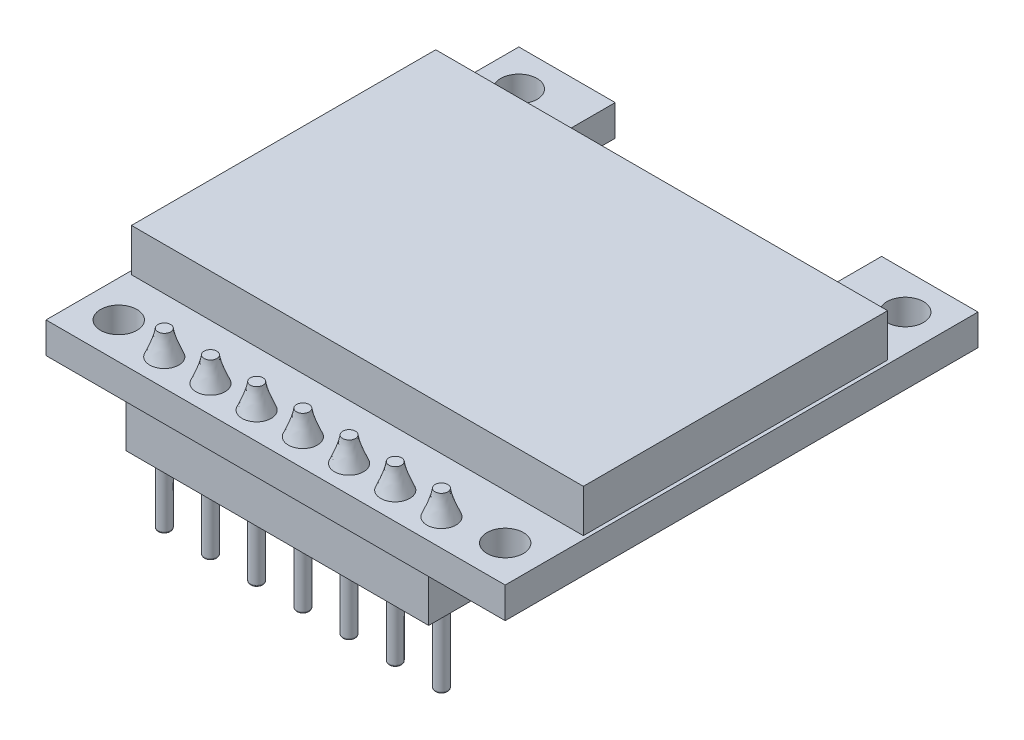
from build123d import *

# Parameters (mm, degrees)
SKETCH_1_W             = 25.25
SKETCH_1_H             = 26
EXTRUDE_1_DEPTH        = 1.7
SKETCH_3_R             = 1
CUT_EXTRUDE_3_DEPTH    = 2
SKETCH_7_W             = 24.85
SKETCH_7_H             = 16.73
EXTRUDE_4_DEPTH        = 2.35
SKETCH_9_W             = 14.65
SKETCH_9_H             = 4.77
CUT_EXTRUDE_5_DEPTH    = 1.7
EXTRUDE_5_DEPTH        = 1.36
EXTRUDE_5_DEPTH_BACK   = 8.2
SKETCH_10_R            = 0.35
PATTERN_LINEAR_1_COUNT = 7
PATTERN_LINEAR_1_PITCH = 2.54
SKETCH_13_W            = 18.36
SKETCH_13_H            = 2.8
EXTRUDE_6_DEPTH        = 2.43
FILLET_2_R             = 0.5
FILLET_3_R             = 0.1
SKETCH_14_W            = 0.86
SKETCH_14_H            = 2.8
CUT_EXTRUDE_6_DEPTH    = 2.5


with BuildPart() as part:
    # 草图1 → 凸台-拉伸1 (new body)
    with BuildSketch(Plane(origin=(0, 0, 0), x_dir=(1, 0, 0), z_dir=(0, 1, 0))):
        Rectangle(SKETCH_1_W, SKETCH_1_H)
    extrude(amount=EXTRUDE_1_DEPTH)

    # 草图3 → 切除-拉伸3 (cut)
    with BuildSketch(Plane(origin=(0, 0, 0), x_dir=(1, 0, 0), z_dir=(0, 1, 0))):
        with Locations(Location((-10.625, -11, 0), (0, 0, 270))):
            Circle(SKETCH_3_R)
        with Locations(Location((10.625, -11, 0), (0, 0, 90))):
            Circle(SKETCH_3_R)
        with Locations(Location((-10.625, 11, 0), (0, 0, 270))):
            Circle(SKETCH_3_R)
        with Locations(Location((10.625, 11, 0), (0, 0, 90))):
            Circle(SKETCH_3_R)
    extrude(amount=CUT_EXTRUDE_3_DEPTH, mode=Mode.SUBTRACT)

    # 草图7 → 凸台-拉伸4 (add)
    with BuildSketch(Plane(origin=(0, 1.7, 0), x_dir=(1, 0, 0), z_dir=(0, 1, 0))):
        with Locations((0, -0.135)):
            Rectangle(SKETCH_7_W, SKETCH_7_H)
    extrude(amount=EXTRUDE_4_DEPTH)

    # 草图9 → 切除-拉伸5 (cut)
    with BuildSketch(Plane(origin=(0, 1.7, 0), x_dir=(1, 0, 0), z_dir=(0, 1, 0))):
        with Locations((0, 10.615)):
            Rectangle(SKETCH_9_W, SKETCH_9_H)
    extrude(amount=-CUT_EXTRUDE_5_DEPTH, mode=Mode.SUBTRACT)

    # 草图10 → 凸台-拉伸5 (add, two sides: drawn at the far end of the back side and taken through both)
    with BuildSketch(Plane(origin=(0, 1.7, 0), x_dir=(1, 0, 0), z_dir=(0, 1, 0)).offset(-EXTRUDE_5_DEPTH_BACK)):
        with Locations(Location((0, -11.5, 0), (0, 0, 270))):
            Circle(SKETCH_10_R)
        with Locations(Location((2.54, -11.5, 0), (0, 0, 270))):
            Circle(SKETCH_10_R)
        with Locations(Location((5.08, -11.5, 0), (0, 0, 270))):
            Circle(SKETCH_10_R)
        with Locations(Location((7.62, -11.5, 0), (0, 0, 270))):
            Circle(SKETCH_10_R)
        with Locations(Location((-2.54, -11.5, 0), (0, 0, 270))):
            Circle(SKETCH_10_R)
        with Locations(Location((-5.08, -11.5, 0), (0, 0, 270))):
            Circle(SKETCH_10_R)
        with Locations(Location((-7.62, -11.5, 0), (0, 0, 270))):
            Circle(SKETCH_10_R)
    extrude(amount=EXTRUDE_5_DEPTH + EXTRUDE_5_DEPTH_BACK)

    # 放样2: read off the stored shape, not the designer's step
    # 放样2: loft between two sections, ruled curve by curve
    loft_2_from = [
        Edge.make_bspline([(7.468197303, 3.06, 11.18463364), (8.098930024, 3.06, 10.881028246), (8.402535418, 3.06, 11.511760967), (7.771802697, 3.06, 11.81536636), (7.141069976, 3.06, 12.118971754), (6.837464582, 3.06, 11.488239033), (7.468197303, 3.06, 11.18463364)], [0, 0, 0, 0, 0.5, 0.5, 0.5, 1, 1, 1, 1], 3, [1, 0.333333333, 0.333333333, 1, 0.333333333, 0.333333333, 1]),
    ]
    loft_2_to = [
        Edge.make_bspline([(7.955612365, 1.7, 10.773801446), (9.408009474, 1.7, 11.445026176), (8.736784744, 1.7, 12.897423284), (7.284387635, 1.7, 12.226198554), (5.831990526, 1.7, 11.554973824), (6.503215256, 1.7, 10.102576716), (7.955612365, 1.7, 10.773801446)], [0, 0, 0, 0, 0.5, 0.5, 0.5, 1, 1, 1, 1], 3, [1, 0.333333333, 0.333333333, 1, 0.333333333, 0.333333333, 1]),
    ]
    loft_2 = Solid(Shell([*[Face.make_surface_from_curves(loft_2_from[k], loft_2_to[k]) for k in range(1)], Face(Wire(loft_2_from)), Face(Wire(loft_2_to))]))
    add(loft_2)

    # 阵列(线性)1: 放样2 ×7
    with Locations(*[(-i * PATTERN_LINEAR_1_PITCH, 0, 0) for i in range(1, PATTERN_LINEAR_1_COUNT)]):
        add(loft_2)

    # 草图13 → 凸台-拉伸6 (add)
    with BuildSketch(Plane(origin=(0, 0, 0), x_dir=(1, 0, 0), z_dir=(0, 1, 0))):
        with Locations((0, -11.5)):
            Rectangle(SKETCH_13_W, SKETCH_13_H)
    extrude(amount=-EXTRUDE_6_DEPTH)

    # 圆角2
    fillet_2_edges = [part.edges().sort_by_distance(p)[0] for p in [
        (9.18, -1.215, 10.1),
        (9.18, -1.215, 12.9),
        (-9.18, -1.215, 12.9),
        (-9.18, -1.215, 10.1),
    ]]
    fillet(fillet_2_edges, radius=FILLET_2_R)

    # 圆角3
    fillet_3_edges = [part.edges().sort_by_distance(p)[0] for p in [
        (0, -6.5, 11.15),
        (2.54, -6.5, 11.15),
        (5.08, -6.5, 11.15),
        (7.62, -6.5, 11.15),
        (-2.54, -6.5, 11.15),
        (-5.08, -6.5, 11.15),
        (-7.62, -6.5, 11.15),
    ]]
    fillet(fillet_3_edges, radius=FILLET_3_R)

    # 草图14 → 切除-拉伸6 (cut)
    with BuildSketch(Plane.XZ):
        with Locations((-8.75, 11.5)):
            Rectangle(SKETCH_14_W, SKETCH_14_H)
        with Locations((8.75, 11.5)):
            Rectangle(SKETCH_14_W, SKETCH_14_H)
    extrude(amount=CUT_EXTRUDE_6_DEPTH, mode=Mode.SUBTRACT)


solid = part.part
